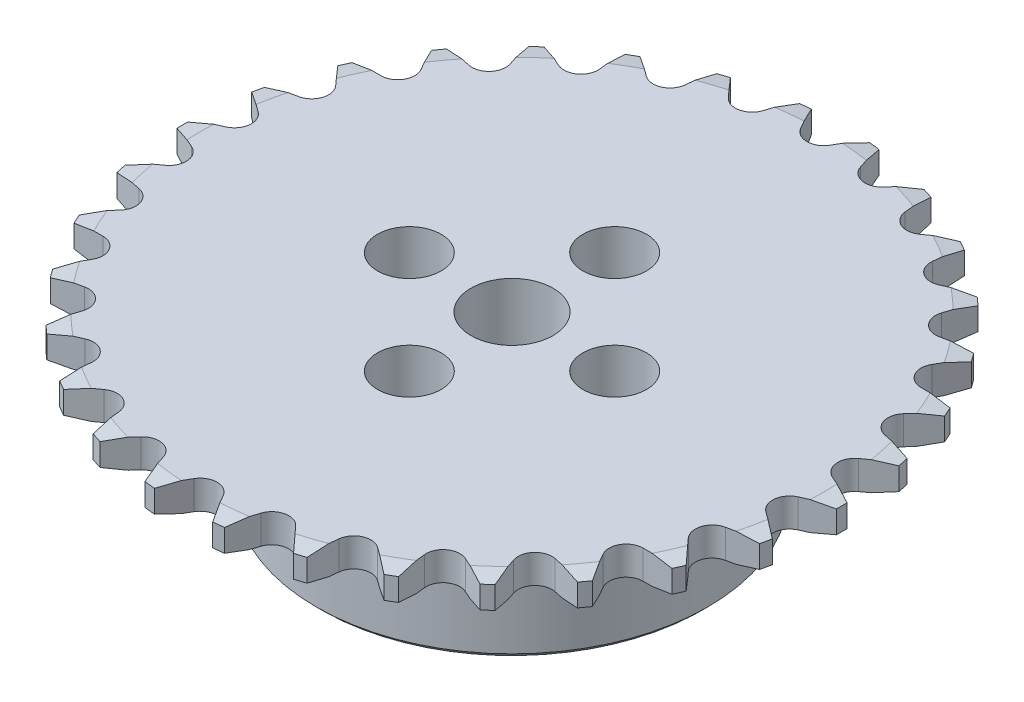
from build123d import *

# Parameters (mm, degrees)
CUT_EXTRUDE1_REACH = 50.109
CIRPATTERN1_START  = -2.794
CIRPATTERN1_DEPTH  = 2.794
SKETCH3_R          = 4
CUT_EXTRUDE2_DEPTH = 49.025751431
SKETCH6_R          = 3.1
CUT_EXTRUDE5_DEPTH = 49.025751431


# Read off the part's stored shape, not the designer's step: CirPattern1
with BuildPart() as part:
    # Sketch1 → Revolve2 (revolve)
    with BuildSketch(Plane.XY, mode=Mode.PRIVATE) as revolve2_sk:
        Polygon((0, 0), (30.374501841, 0), (32.113107142, -0.306563023), (32.113107142, -2.487436977), (30.374501841, -2.794), (19.05, -2.794), (19.05, -15.375), (18.55, -15.875), (0, -15.875), align=None)
    revolve(revolve2_sk.sketch.rotate(Axis((0, 0, 0), (0, -1, 0)), 180), axis=Axis((0, 0, 0), (0, -1, 0)))

    # Cut-Extrude1: up to this face of the body (flat: up to its plane)
    cut_extrude1_end = Plane(part.part.faces().sort_by_distance((29.515381192, -2.794, 0))[0])
    # Sketch2 → Cut-Extrude1 (cut, up to the picked face)
    with BuildSketch(Plane(origin=(0, 0, 0), x_dir=(1, 0, 0), z_dir=(0, 1, 0)), mode=Mode.PRIVATE) as cut_extrude1_sk1:
        with BuildLine():
            Line((1.428941916, 29.549501841), (2.836569262, 31.987583922))
            ThreePointArc((2.836569262, 31.987583922), (0, 32.113107142), (-2.836569262, 31.987583922))
            Line((-2.836569262, 31.987583922), (-1.428941916, 29.549501841))
            ThreePointArc((-1.428941916, 29.549501841), (0, 28.724501841), (1.428941916, 29.549501841))
        make_face()
    cut_extrude1_tool1 = split(extrude(cut_extrude1_sk1.sketch, amount=-CUT_EXTRUDE1_REACH, mode=Mode.PRIVATE), bisect_by=cut_extrude1_end, keep=Keep.BOTH, mode=Mode.PRIVATE)
    add(cut_extrude1_tool1.solids().sort_by(Axis((0, 0, -30.720189), (0, -1, 0)))[0], mode=Mode.SUBTRACT)

    # CirPattern1 outline → CirPattern1 (cut)
    with BuildSketch(Plane(origin=(0, 0, 0), x_dir=(1, 0, 0), z_dir=(0, 1, 0)).offset(CIRPATTERN1_START)):
        with BuildLine():
            ThreePointArc((-29.120344913, -13.537250921), (-27.810766579, -16.056553571), (-26.283775651, -18.450333001))
            Line((-26.283775651, -18.450333001), (-24.876148306, -16.012250921))
            ThreePointArc((-24.876148306, -16.012250921), (-24.876148306, -14.362250921), (-26.305090222, -13.537250921))
            Line((-26.305090222, -13.537250921), (-29.120344913, -13.537250921))
        make_face()
        with BuildLine():
            ThreePointArc((-3.876009241, 31.878334378), (-6.676690404, 31.411358704), (-9.425176076, 30.698822555))
            Line((-9.425176076, 30.698822555), (-7.541402998, 28.606680599))
            ThreePointArc((-7.541402998, 28.606680599), (-5.972159746, 28.096802558), (-4.745970784, 29.200868059))
            Line((-4.745970784, 29.200868059), (-3.876009241, 31.878334378))
        make_face()
        with BuildLine():
            ThreePointArc((-10.41918754, 30.375848652), (-13.061577398, 29.336783161), (-15.601857469, 28.068375333))
            Line((-15.601857469, 28.068375333), (-13.32426858, 26.413610145))
            ThreePointArc((-13.32426858, 26.413610145), (-11.683307453, 26.24113818), (-10.713461787, 27.576016221))
            Line((-10.713461787, 27.576016221), (-10.41918754, 30.375848652))
        make_face()
        with BuildLine():
            ThreePointArc((-16.506997347, 27.545792581), (-18.875610783, 25.980049421), (-21.096662824, 24.211205423))
            Line((-21.096662824, 24.211205423), (-18.524799689, 23.06613818))
            ThreePointArc((-18.524799689, 23.06613818), (-16.883838562, 23.238610145), (-16.212723101, 24.74596015))
            Line((-16.212723101, 24.74596015), (-16.506997347, 27.545792581))
        make_face()
        with BuildLine():
            ThreePointArc((-21.873372161, 23.511853194), (-23.864689403, 21.487862854), (-25.669442781, 19.295889657))
            Line((-25.669442781, 19.295889657), (-22.91570816, 18.710565294))
            ThreePointArc((-22.91570816, 18.710565294), (-21.346464908, 19.220443334), (-21.003410618, 20.834386876))
            Line((-21.003410618, 20.834386876), (-21.873372161, 23.511853194))
        make_face()
        with BuildLine():
            ThreePointArc((-26.283775651, 18.450333001), (-27.81076658, 16.056553571), (-29.120344913, 13.537250921))
            Line((-29.120344913, 13.537250921), (-26.305090222, 13.537250921))
            ThreePointArc((-26.305090222, 13.537250921), (-24.876148306, 14.362250921), (-24.876148306, 16.012250921))
            Line((-24.876148306, 16.012250921), (-26.283775651, 18.450333001))
        make_face()
        with BuildLine():
            ThreePointArc((-29.545452022, 12.582444721), (-30.541379806, 9.923495849), (-31.298548237, 7.186969361))
            Line((-31.298548237, 7.186969361), (-28.544813616, 7.772293723))
            ThreePointArc((-28.544813616, 7.772293723), (-27.318624654, 8.876359224), (-27.661678943, 10.490302765))
            Line((-27.661678943, 10.490302765), (-29.545452022, 12.582444721))
        make_face()
        with BuildLine():
            ThreePointArc((-31.515850364, 6.164643229), (-31.937188181, 3.35673374), (-32.108854816, 0.522582753))
            Line((-32.108854816, 0.522582753), (-29.536991681, 1.667649995))
            ThreePointArc((-29.536991681, 1.667649995), (-28.567146015, 3.002528036), (-29.238261476, 4.509878041))
            Line((-29.238261476, 4.509878041), (-31.515850364, 6.164643229))
        make_face()
        with BuildLine():
            ThreePointArc((-32.108854816, -0.522582753), (-31.937188181, -3.35673374), (-31.515850364, -6.164643229))
            Line((-31.515850364, -6.164643229), (-29.238261476, -4.509878041))
            ThreePointArc((-29.238261476, -4.509878041), (-28.567146015, -3.002528036), (-29.536991681, -1.667649995))
            Line((-29.536991681, -1.667649995), (-32.108854816, -0.522582753))
        make_face()
        with BuildLine():
            ThreePointArc((-31.298548237, -7.186969361), (-30.541379806, -9.923495849), (-29.545452022, -12.582444721))
            Line((-29.545452022, -12.582444721), (-27.661678943, -10.490302765))
            ThreePointArc((-27.661678943, -10.490302765), (-27.318624654, -8.876359224), (-28.544813616, -7.772293723))
            Line((-28.544813616, -7.772293723), (-31.298548237, -7.186969361))
        make_face()
        with BuildLine():
            Line((7.541402998, 28.606680599), (9.425176076, 30.698822555))
            ThreePointArc((9.425176076, 30.698822555), (6.676690404, 31.411358704), (3.876009241, 31.878334378))
            Line((3.876009241, 31.878334378), (4.745970784, 29.200868059))
            ThreePointArc((4.745970784, 29.200868059), (5.972159746, 28.096802558), (7.541402998, 28.606680599))
        make_face()
        with BuildLine():
            Line((13.32426858, 26.413610145), (15.601857469, 28.068375333))
            ThreePointArc((15.601857469, 28.068375333), (13.061577398, 29.336783161), (10.41918754, 30.375848652))
            Line((10.41918754, 30.375848652), (10.713461787, 27.576016221))
            ThreePointArc((10.713461787, 27.576016221), (11.683307453, 26.24113818), (13.32426858, 26.413610145))
        make_face()
        with BuildLine():
            Line((18.524799689, 23.06613818), (21.096662824, 24.211205423))
            ThreePointArc((21.096662824, 24.211205423), (18.875610783, 25.980049421), (16.506997347, 27.545792581))
            Line((16.506997347, 27.545792581), (16.212723101, 24.74596015))
            ThreePointArc((16.212723101, 24.74596015), (16.883838562, 23.238610145), (18.524799689, 23.06613818))
        make_face()
        with BuildLine():
            Line((22.91570816, 18.710565294), (25.669442781, 19.295889657))
            ThreePointArc((25.669442781, 19.295889657), (23.864689403, 21.487862854), (21.873372161, 23.511853194))
            Line((21.873372161, 23.511853194), (21.003410618, 20.834386876))
            ThreePointArc((21.003410618, 20.834386876), (21.346464908, 19.220443334), (22.91570816, 18.710565294))
        make_face()
        with BuildLine():
            Line((26.305090222, 13.537250921), (29.120344913, 13.537250921))
            ThreePointArc((29.120344913, 13.537250921), (27.81076658, 16.056553571), (26.283775651, 18.450333001))
            Line((26.283775651, 18.450333001), (24.876148306, 16.012250921))
            ThreePointArc((24.876148306, 16.012250921), (24.876148306, 14.362250921), (26.305090222, 13.537250921))
        make_face()
        with BuildLine():
            Line((28.544813616, 7.772293723), (31.298548237, 7.186969361))
            ThreePointArc((31.298548237, 7.186969361), (30.541379806, 9.923495849), (29.545452022, 12.582444721))
            Line((29.545452022, 12.582444721), (27.661678943, 10.490302765))
            ThreePointArc((27.661678943, 10.490302765), (27.318624654, 8.876359224), (28.544813616, 7.772293723))
        make_face()
        with BuildLine():
            Line((29.536991681, 1.667649995), (32.108854816, 0.522582753))
            ThreePointArc((32.108854816, 0.522582753), (31.937188181, 3.35673374), (31.515850364, 6.164643229))
            Line((31.515850364, 6.164643229), (29.238261476, 4.509878041))
            ThreePointArc((29.238261476, 4.509878041), (28.567146015, 3.002528036), (29.536991681, 1.667649995))
        make_face()
        with BuildLine():
            Line((29.238261476, -4.509878041), (31.515850364, -6.164643229))
            ThreePointArc((31.515850364, -6.164643229), (31.937188181, -3.35673374), (32.108854816, -0.522582753))
            Line((32.108854816, -0.522582753), (29.536991681, -1.667649995))
            ThreePointArc((29.536991681, -1.667649995), (28.567146015, -3.002528036), (29.238261476, -4.509878041))
        make_face()
        with BuildLine():
            Line((27.661678943, -10.490302765), (29.545452022, -12.582444721))
            ThreePointArc((29.545452022, -12.582444721), (30.541379806, -9.923495849), (31.298548237, -7.186969361))
            Line((31.298548237, -7.186969361), (28.544813616, -7.772293723))
            ThreePointArc((28.544813616, -7.772293723), (27.318624654, -8.876359224), (27.661678943, -10.490302765))
        make_face()
        with BuildLine():
            Line((24.876148306, -16.012250921), (26.283775651, -18.450333001))
            ThreePointArc((26.283775651, -18.450333001), (27.810766579, -16.056553571), (29.120344913, -13.537250921))
            Line((29.120344913, -13.537250921), (26.305090222, -13.537250921))
            ThreePointArc((26.305090222, -13.537250921), (24.876148306, -14.362250921), (24.876148306, -16.012250921))
        make_face()
        with BuildLine():
            Line((21.003410618, -20.834386876), (21.873372161, -23.511853194))
            ThreePointArc((21.873372161, -23.511853194), (23.864689403, -21.487862854), (25.669442781, -19.295889657))
            Line((25.669442781, -19.295889657), (22.91570816, -18.710565294))
            ThreePointArc((22.91570816, -18.710565294), (21.346464908, -19.220443334), (21.003410618, -20.834386876))
        make_face()
        with BuildLine():
            Line((16.212723101, -24.74596015), (16.506997347, -27.545792581))
            ThreePointArc((16.506997347, -27.545792581), (18.875610783, -25.98004942), (21.096662824, -24.211205423))
            Line((21.096662824, -24.211205423), (18.524799689, -23.06613818))
            ThreePointArc((18.524799689, -23.06613818), (16.883838562, -23.238610145), (16.212723101, -24.74596015))
        make_face()
        with BuildLine():
            Line((10.713461787, -27.576016221), (10.41918754, -30.375848652))
            ThreePointArc((10.41918754, -30.375848652), (13.061577398, -29.33678316), (15.601857469, -28.068375333))
            Line((15.601857469, -28.068375333), (13.32426858, -26.413610145))
            ThreePointArc((13.32426858, -26.413610145), (11.683307453, -26.24113818), (10.713461787, -27.576016221))
        make_face()
        with BuildLine():
            Line((4.745970784, -29.200868059), (3.876009241, -31.878334377))
            ThreePointArc((3.876009241, -31.878334377), (6.676690403, -31.411358703), (9.425176076, -30.698822555))
            Line((9.425176076, -30.698822555), (7.541402998, -28.606680599))
            ThreePointArc((7.541402998, -28.606680599), (5.972159746, -28.096802558), (4.745970784, -29.200868059))
        make_face()
        with BuildLine():
            Line((-1.428941916, -29.549501841), (-2.836569262, -31.987583922))
            ThreePointArc((-2.836569262, -31.987583922), (0, -32.113107142), (2.836569262, -31.987583922))
            Line((2.836569262, -31.987583922), (1.428941916, -29.549501841))
            ThreePointArc((1.428941916, -29.549501841), (0, -28.724501841), (-1.428941916, -29.549501841))
        make_face()
        with BuildLine():
            Line((-7.541402998, -28.606680599), (-9.425176076, -30.698822555))
            ThreePointArc((-9.425176076, -30.698822555), (-6.676690403, -31.411358703), (-3.876009241, -31.878334377))
            Line((-3.876009241, -31.878334377), (-4.745970784, -29.200868059))
            ThreePointArc((-4.745970784, -29.200868059), (-5.972159746, -28.096802558), (-7.541402998, -28.606680599))
        make_face()
        with BuildLine():
            Line((-13.32426858, -26.413610145), (-15.601857469, -28.068375333))
            ThreePointArc((-15.601857469, -28.068375333), (-13.061577398, -29.33678316), (-10.41918754, -30.375848652))
            Line((-10.41918754, -30.375848652), (-10.713461787, -27.576016221))
            ThreePointArc((-10.713461787, -27.576016221), (-11.683307453, -26.24113818), (-13.32426858, -26.413610145))
        make_face()
        with BuildLine():
            Line((-18.524799689, -23.06613818), (-21.096662824, -24.211205423))
            ThreePointArc((-21.096662824, -24.211205423), (-18.875610783, -25.98004942), (-16.506997347, -27.545792581))
            Line((-16.506997347, -27.545792581), (-16.212723101, -24.74596015))
            ThreePointArc((-16.212723101, -24.74596015), (-16.883838562, -23.238610145), (-18.524799689, -23.06613818))
        make_face()
        with BuildLine():
            Line((-22.91570816, -18.710565294), (-25.669442781, -19.295889657))
            ThreePointArc((-25.669442781, -19.295889657), (-23.864689403, -21.487862854), (-21.873372161, -23.511853194))
            Line((-21.873372161, -23.511853194), (-21.003410618, -20.834386876))
            ThreePointArc((-21.003410618, -20.834386876), (-21.346464908, -19.220443334), (-22.91570816, -18.710565294))
        make_face()
    extrude(amount=CIRPATTERN1_DEPTH, mode=Mode.SUBTRACT)

    # Sketch3 → Cut-Extrude2 (cut, through all)
    with BuildSketch(Plane.XZ.offset(15.875)):
        Circle(SKETCH3_R)
    extrude(amount=-CUT_EXTRUDE2_DEPTH, mode=Mode.SUBTRACT)

    # Sketch6 → Cut-Extrude5 (cut, through all)
    with BuildSketch(Plane(origin=(0, 0, 0), x_dir=(1, 0, 0), z_dir=(0, 1, 0))):
        with Locations(Location((0, 10, 0), (0, 0, 180))):
            Circle(SKETCH6_R)
        with Locations(Location((10, 0, 0), (0, 0, 180))):
            Circle(SKETCH6_R)
        with Locations(Location((0, -10, 0), (0, 0, 180))):
            Circle(SKETCH6_R)
        with Locations(Location((-10, 0, 0), (0, 0, 180))):
            Circle(SKETCH6_R)
    extrude(amount=-CUT_EXTRUDE5_DEPTH, mode=Mode.SUBTRACT)


solid = part.part
